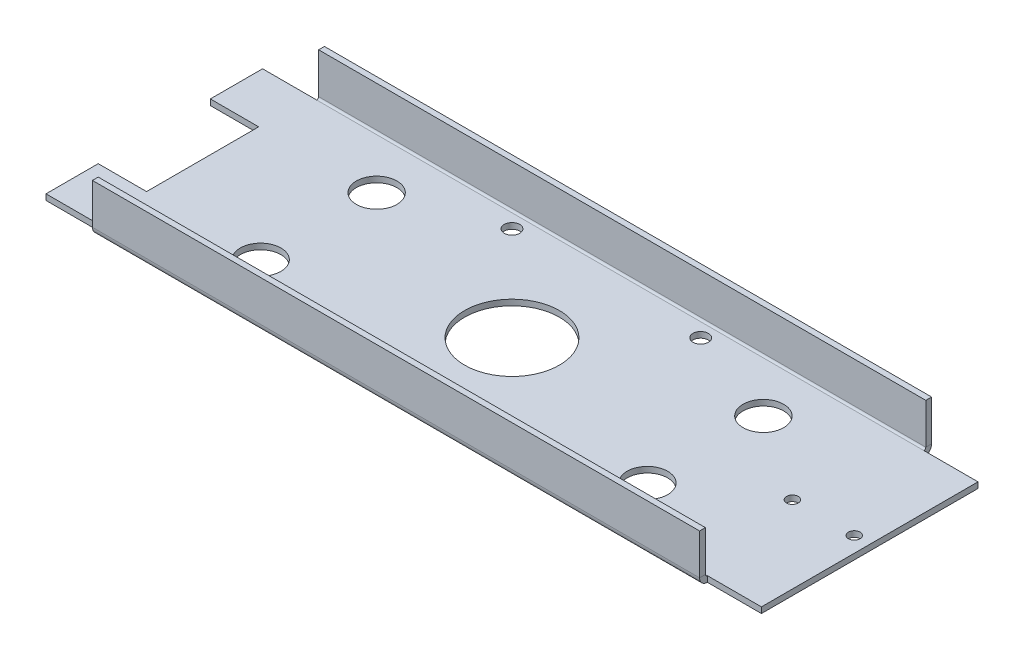
from build123d import *

# Parameters (mm, degrees)
SKETCH1_W                      = 370
SKETCH1_H                      = 114
SKETCH1_R                      = 4
SKETCH1_R_2                    = 24.5
BOSS_EXTRUDE1_DEPTH            = 3
EDGE_FLANGE1_STRIP_W           = 14
EDGE_FLANGE1_STRIP_H           = 3
EDGE_FLANGE1_STRIP_CUT_DEPTH   = 370
EDGE_FLANGE1_STRIP_2_W         = 14
EDGE_FLANGE1_STRIP_2_H         = 3
EDGE_FLANGE1_STRIP_CUT_2_DEPTH = 370
EDGE_FLANGE1_DEPTH             = 370
EDGE_FLANGE1_BEND_DEPTH        = 370
CUT_EXTRUDE1_REACH             = 198.087
SKETCH16_R                     = 3
SKETCH16_W                     = 25
SKETCH16_H                     = 58
CUT_EXTRUDE2_REACH             = 197.727
SKETCH17_R                     = 10.5
CUT_EXTRUDE3_START             = -185
CUT_EXTRUDE3_DEPTH             = 28
CUT_EXTRUDE3_START_2           = 157
CUT_EXTRUDE3_2_DEPTH           = 28


# Read off the part's stored shape, not the designer's step: Cut-Extrude3
# Sheet-metal steps are written as plain solids
with BuildPart() as part:
    # Sketch1 → Boss-Extrude1 (new body)
    with BuildSketch(Plane(origin=(0, 0, 0), x_dir=(1, 0, 0), z_dir=(0, 1, 0))):
        Rectangle(SKETCH1_W, SKETCH1_H)
        with Locations(Location((-48.790367902, 48.790367902, 0), (0, 0, 270))):
            Circle(SKETCH1_R, mode=Mode.SUBTRACT)
        with Locations(Location((48.790367902, 48.790367902, 0), (0, 0, 270))):
            Circle(SKETCH1_R, mode=Mode.SUBTRACT)
        with Locations(Location((48.790367902, -48.790367902, 0), (0, 0, 270))):
            Circle(SKETCH1_R, mode=Mode.SUBTRACT)
        with Locations(Location((-48.790367902, -48.790367902, 0), (0, 0, 270))):
            Circle(SKETCH1_R, mode=Mode.SUBTRACT)
        with Locations(Location((0, 0, 0), (0, 0, 270))):
            Circle(SKETCH1_R_2, mode=Mode.SUBTRACT)
    extrude(amount=BOSS_EXTRUDE1_DEPTH)

    # Edge-Flange1 strip (across the edge) → Edge-Flange1 strip cut (cut)
    with BuildSketch(Plane(origin=(-185, 3, 57), x_dir=(0, 0, -1), z_dir=(1, 0, 0))):
        with Locations((-6, -1.5)):
            Rectangle(EDGE_FLANGE1_STRIP_W, EDGE_FLANGE1_STRIP_H)
    extrude(amount=EDGE_FLANGE1_STRIP_CUT_DEPTH, mode=Mode.SUBTRACT)

    # Edge-Flange1 strip 2 (across the edge) → Edge-Flange1 strip cut 2 (cut)
    with BuildSketch(Plane(origin=(185, 3, -57), x_dir=(0, 0, 1), z_dir=(-1, 0, 0))):
        with Locations((-6, -1.5)):
            Rectangle(EDGE_FLANGE1_STRIP_2_W, EDGE_FLANGE1_STRIP_2_H)
    extrude(amount=EDGE_FLANGE1_STRIP_CUT_2_DEPTH, mode=Mode.SUBTRACT)

    # Edge-Flange1 section (across the edge) → Edge-Flange1 (add)
    with BuildSketch(Plane(origin=(-185, 3, 57), x_dir=(0, 0, -1), z_dir=(1, 0, 0))):
        with BuildLine():
            Line((-3, 1), (-3, 22))
            Line((-3, 22), (0, 22))
            Line((0, 22), (0, 1))
            ThreePointArc((0, 1), (0.292893219, 0.292893219), (1, 0))
            Line((1, 0), (1, -3))
            ThreePointArc((1, -3), (-1.828427125, -1.828427125), (-3, 1))
        make_face()
    extrude(amount=EDGE_FLANGE1_DEPTH)

    # Edge-Flange1 section 2 (across the edge) → Edge-Flange1 bend (add)
    with BuildSketch(Plane(origin=(185, 3, -57), x_dir=(0, 0, 1), z_dir=(-1, 0, 0))):
        with BuildLine():
            Line((-3, 1), (-3, 22))
            Line((-3, 22), (0, 22))
            Line((0, 22), (0, 1))
            ThreePointArc((0, 1), (0.292893219, 0.292893219), (1, 0))
            Line((1, 0), (1, -3))
            ThreePointArc((1, -3), (-1.828427125, -1.828427125), (-3, 1))
        make_face()
    extrude(amount=EDGE_FLANGE1_BEND_DEPTH)

    # Sketch16 → Cut-Extrude1 (cut, up to next)
    with BuildSketch(Plane.XZ, mode=Mode.PRIVATE) as cut_extrude1_sk1:
        with Locations(Location((177, 0, 0), (0, 0, 270))):
            Circle(SKETCH16_R)
    cut_extrude1_tool1 = extrude(cut_extrude1_sk1.sketch, amount=-CUT_EXTRUDE1_REACH, mode=Mode.PRIVATE) & part.part
    # Sketch16 → Cut-Extrude1 (cut, up to next)
    with BuildSketch(Plane.XZ, mode=Mode.PRIVATE) as cut_extrude1_sk2:
        with Locations(Location((145, 0, 0), (0, 0, 270))):
            Circle(SKETCH16_R)
    cut_extrude1_tool2 = extrude(cut_extrude1_sk2.sketch, amount=-CUT_EXTRUDE1_REACH, mode=Mode.PRIVATE) & part.part
    # Sketch16 → Cut-Extrude1 (cut, up to next)
    with BuildSketch(Plane.XZ, mode=Mode.PRIVATE) as cut_extrude1_sk3:
        with Locations((-172.5, 0)):
            Rectangle(SKETCH16_W, SKETCH16_H)
    cut_extrude1_tool3 = extrude(cut_extrude1_sk3.sketch, amount=-CUT_EXTRUDE1_REACH, mode=Mode.PRIVATE) & part.part
    add(cut_extrude1_tool1.solids().sort_by_distance((177, 0, 0))[0], mode=Mode.SUBTRACT)
    add(cut_extrude1_tool2.solids().sort_by_distance((145, 0, 0))[0], mode=Mode.SUBTRACT)
    add(cut_extrude1_tool3.solids().sort_by_distance((-172.5, 0, 0))[0], mode=Mode.SUBTRACT)

    # Sketch17 → Cut-Extrude2 (cut, up to next)
    with BuildSketch(Plane(origin=(0, 3, 0), x_dir=(1, 0, 0), z_dir=(0, 1, 0)), mode=Mode.PRIVATE) as cut_extrude2_sk1:
        with Locations(Location((-100, 30, 0), (0, 0, 270))):
            Circle(SKETCH17_R)
    cut_extrude2_tool1 = extrude(cut_extrude2_sk1.sketch, amount=-CUT_EXTRUDE2_REACH, mode=Mode.PRIVATE) & part.part
    # Sketch17 → Cut-Extrude2 (cut, up to next)
    with BuildSketch(Plane(origin=(0, 3, 0), x_dir=(1, 0, 0), z_dir=(0, 1, 0)), mode=Mode.PRIVATE) as cut_extrude2_sk2:
        with Locations(Location((100, 30, 0), (0, 0, 90))):
            Circle(SKETCH17_R)
    cut_extrude2_tool2 = extrude(cut_extrude2_sk2.sketch, amount=-CUT_EXTRUDE2_REACH, mode=Mode.PRIVATE) & part.part
    # Sketch17 → Cut-Extrude2 (cut, up to next)
    with BuildSketch(Plane(origin=(0, 3, 0), x_dir=(1, 0, 0), z_dir=(0, 1, 0)), mode=Mode.PRIVATE) as cut_extrude2_sk3:
        with Locations(Location((100, -30, 0), (0, 0, 270))):
            Circle(SKETCH17_R)
    cut_extrude2_tool3 = extrude(cut_extrude2_sk3.sketch, amount=-CUT_EXTRUDE2_REACH, mode=Mode.PRIVATE) & part.part
    # Sketch17 → Cut-Extrude2 (cut, up to next)
    with BuildSketch(Plane(origin=(0, 3, 0), x_dir=(1, 0, 0), z_dir=(0, 1, 0)), mode=Mode.PRIVATE) as cut_extrude2_sk4:
        with Locations(Location((-100, -30, 0), (0, 0, 90))):
            Circle(SKETCH17_R)
    cut_extrude2_tool4 = extrude(cut_extrude2_sk4.sketch, amount=-CUT_EXTRUDE2_REACH, mode=Mode.PRIVATE) & part.part
    add(cut_extrude2_tool1.solids().sort_by_distance((-100, 3, -30))[0], mode=Mode.SUBTRACT)
    add(cut_extrude2_tool2.solids().sort_by_distance((100, 3, -30))[0], mode=Mode.SUBTRACT)
    add(cut_extrude2_tool3.solids().sort_by_distance((100, 3, 30))[0], mode=Mode.SUBTRACT)
    add(cut_extrude2_tool4.solids().sort_by_distance((-100, 3, 30))[0], mode=Mode.SUBTRACT)

    # Cut-Extrude3 outline → Cut-Extrude3 (cut)
    with BuildSketch(Plane.YZ.offset(CUT_EXTRUDE3_START)):
        with BuildLine():
            ThreePointArc((4, -57), (3.292893219, -56.707106781), (3, -56))
            Line((3, -56), (0, -56))
            ThreePointArc((0, -56), (1.171572875, -58.828427125), (4, -60))
            Line((4, -60), (25, -60))
            Line((25, -60), (25, -57))
            Line((25, -57), (4, -57))
        make_face()
        with BuildLine():
            ThreePointArc((4, 60), (1.171572875, 58.828427125), (0, 56))
            Line((0, 56), (3, 56))
            ThreePointArc((3, 56), (3.292893219, 56.707106781), (4, 57))
            Line((4, 57), (25, 57))
            Line((25, 57), (25, 60))
            Line((25, 60), (4, 60))
        make_face()
    extrude(amount=CUT_EXTRUDE3_DEPTH, mode=Mode.SUBTRACT)

    # Cut-Extrude3 2 outline → Cut-Extrude3 2 (cut)
    with BuildSketch(Plane.YZ.offset(CUT_EXTRUDE3_START_2)):
        with BuildLine():
            ThreePointArc((4, -57), (3.292893219, -56.707106781), (3, -56))
            Line((3, -56), (0, -56))
            ThreePointArc((0, -56), (1.171572875, -58.828427125), (4, -60))
            Line((4, -60), (25, -60))
            Line((25, -60), (25, -57))
            Line((25, -57), (4, -57))
        make_face()
        with BuildLine():
            ThreePointArc((4, 60), (1.171572875, 58.828427125), (0, 56))
            Line((0, 56), (3, 56))
            ThreePointArc((3, 56), (3.292893219, 56.707106781), (4, 57))
            Line((4, 57), (25, 57))
            Line((25, 57), (25, 60))
            Line((25, 60), (4, 60))
        make_face()
    extrude(amount=CUT_EXTRUDE3_2_DEPTH, mode=Mode.SUBTRACT)


solid = part.part
